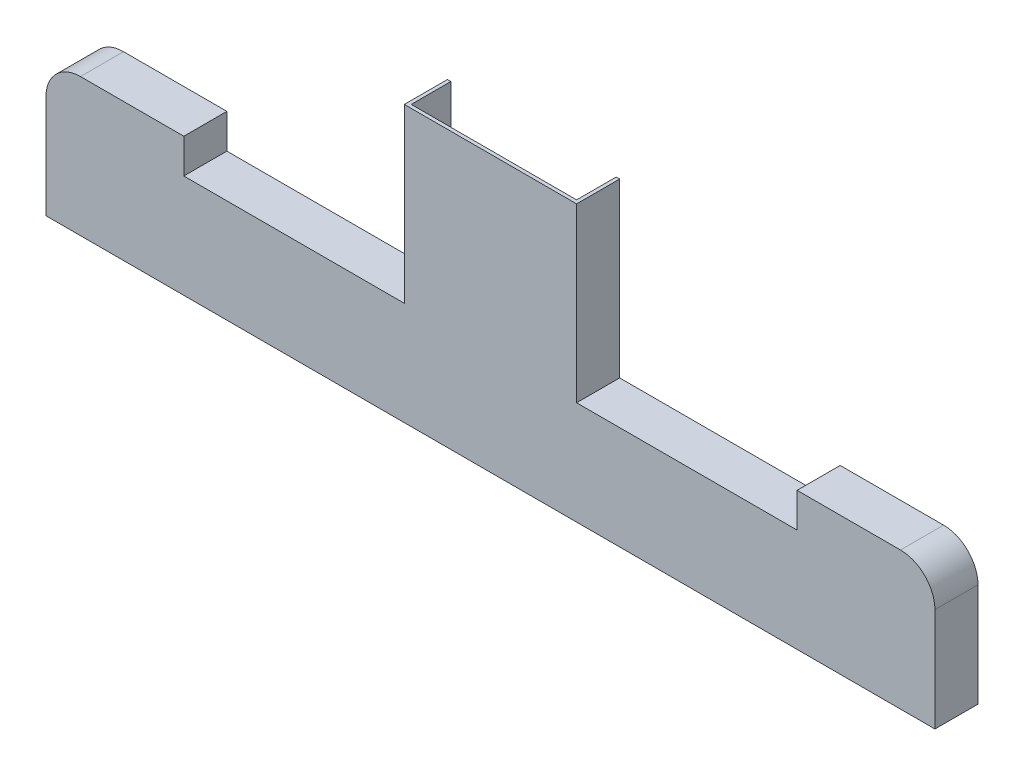
from build123d import *

# Parameters (mm, degrees)
BOSS_EXTRUDE1_DEPTH = 25
SKETCH2_W           = 96
SKETCH2_H           = 23
CUT_EXTRUDE1_DEPTH  = 100
SHELL3_START        = -25
SHELL3_DEPTH        = 23


# Read off the part's stored shape, not the designer's step: Shell3
with BuildPart() as part:
    # Sketch1 → Boss-Extrude1 (new body)
    with BuildSketch(Plane.XY):
        with BuildLine():
            Line((0, 0), (516, 0))
            Line((516, 0), (516, 60))
            ThreePointArc((516, 60), (510.142135624, 74.142135624), (496, 80))
            Line((496, 80), (436, 80))
            Line((436, 80), (436, 60))
            Line((436, 60), (308, 60))
            Line((308, 60), (308, 160))
            Line((308, 160), (208, 160))
            Line((208, 160), (208, 60))
            Line((208, 60), (80, 60))
            Line((80, 60), (80, 80))
            Line((80, 80), (20, 80))
            ThreePointArc((20, 80), (5.857864376, 74.142135624), (0, 60))
            Line((0, 60), (0, 0))
        make_face()
    extrude(amount=-BOSS_EXTRUDE1_DEPTH)

    # Sketch2 → Cut-Extrude1 (cut)
    with BuildSketch(Plane(origin=(0, 160, 0), x_dir=(1, 0, 0), z_dir=(0, 1, 0))):
        with Locations((258, 13.5)):
            Rectangle(SKETCH2_W, SKETCH2_H)
    extrude(amount=-CUT_EXTRUDE1_DEPTH, mode=Mode.SUBTRACT)

    # Shell3 outline → Shell3 (cut)
    with BuildSketch(Plane.XY.offset(SHELL3_START)):
        with BuildLine():
            ThreePointArc((20, 78), (7.272077939, 72.727922061), (2, 60))
            Line((2, 60), (2, 2))
            Line((2, 2), (514, 2))
            Line((514, 2), (514, 60))
            ThreePointArc((514, 60), (508.727922061, 72.727922061), (496, 78))
            Line((496, 78), (438, 78))
            Line((438, 78), (438, 58))
            Line((438, 58), (78, 58))
            Line((78, 58), (78, 78))
            Line((78, 78), (20, 78))
        make_face()
    extrude(amount=SHELL3_DEPTH, mode=Mode.SUBTRACT)


solid = part.part
